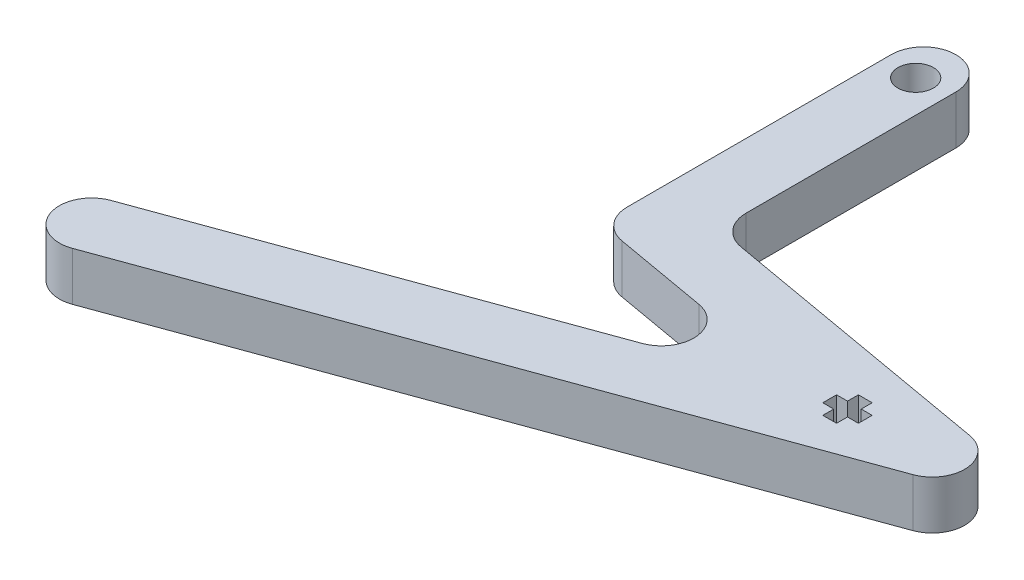
from build123d import *

# Parameters (mm, degrees)
SKETCH1_R           = 2.2
BOSS_EXTRUDE1_DEPTH = 6
FILLET1_R           = 4


with BuildPart() as part:
    # Sketch1 → Boss-Extrude1 (new body)
    with BuildSketch(Plane(origin=(0, 0, 0), x_dir=(1, 0, 0), z_dir=(0, 1, 0))):
        Polygon((-71.479040749, 49.048444694), (-71.479040749, 9.048444694), (-41.934808158, 3.838999364), (-107.848225403, -20.151522552), (-105.112064256, -27.669063518), (-11.142802178, 6.532950815), (-63.479040749, 15.761241744), (-63.479040749, 49.048444694), align=None)
        with Locations(Location((-67.479040749, 44.077475717, 0), (0, 0, 270))):
            Circle(SKETCH1_R, mode=Mode.SUBTRACT)
        Polygon((-38.433012349, 5.25170526), (-38.433012349, 3.55170526), (-37.083012349, 3.55170526), (-37.083012349, 2.20170526), (-35.383012349, 2.20170526), (-35.383012349, 3.55170526), (-34.033012349, 3.55170526), (-34.033012349, 5.25170526), (-35.383012349, 5.25170526), (-35.383012349, 6.60170526), (-37.083012349, 6.60170526), (-37.083012349, 5.25170526), align=None, mode=Mode.SUBTRACT)
    extrude(amount=BOSS_EXTRUDE1_DEPTH)

    # Fillet1
    fillet1_edges = [part.edges().sort_by_distance(p)[0] for p in [
        (-63.479040749, 3, -15.761241744),
        (-71.479040749, 3, -9.048444694),
        (-105.112064256, 3, 27.669063518),
        (-107.848225403, 3, 20.151522552),
        (-41.934808158, 3, -3.838999364),
        (-11.142802178, 3, -6.532950815),
        (-63.479040749, 3, -49.048444694),
        (-71.479040749, 3, -49.048444694),
    ]]
    fillet(fillet1_edges, radius=FILLET1_R - 0.0001)  # a hair under: the kernel refuses the full size


solid = part.part
